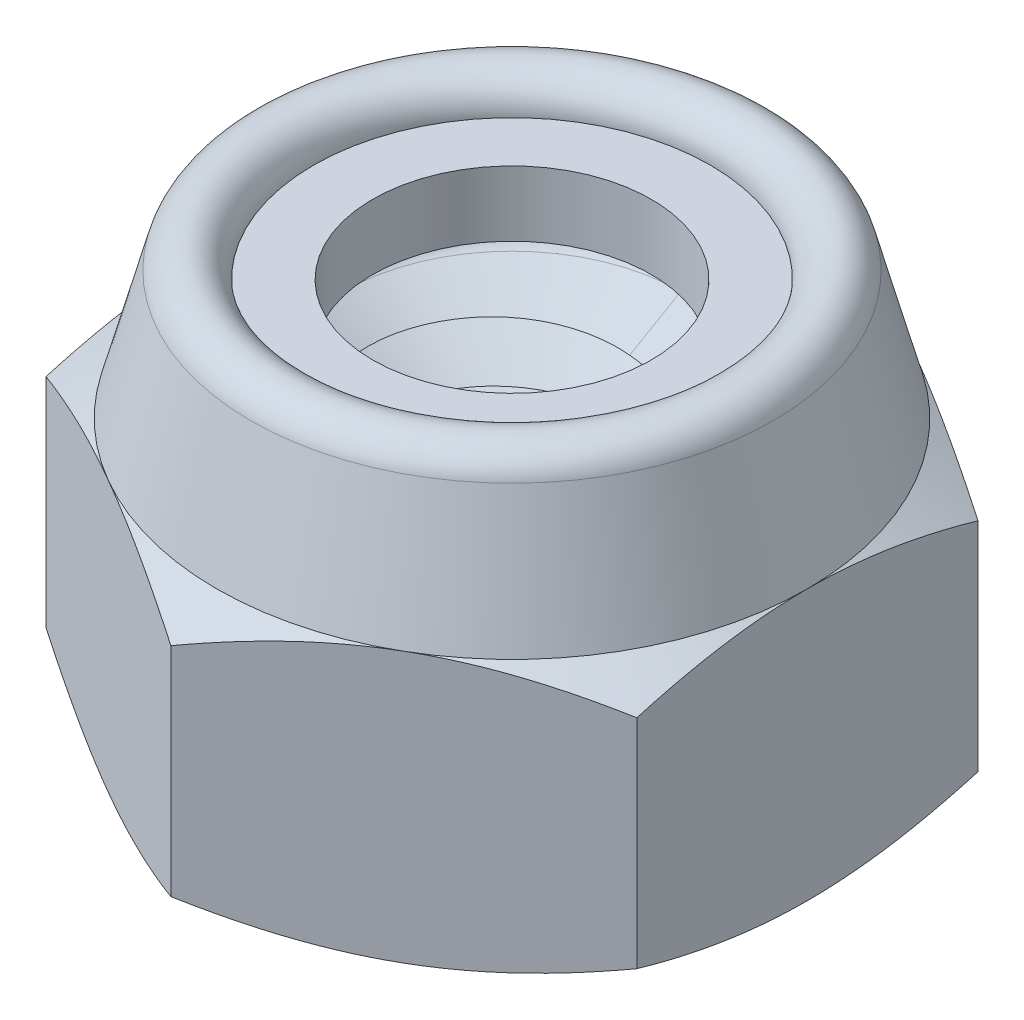
from build123d import *
from build123d.topology import SkipClean

# Parameters (mm, degrees)
SKETCH2_R           = 2
BOSS_EXTRUDE1_DEPTH = 3.2
CUT_SWEEP1_PITCH    = 0.7


with BuildPart() as part:
    # Sketch1 → Revolve1 (revolve)
    with BuildSketch(Plane(origin=(0, 0, 0), x_dir=(0, 0, -1), z_dir=(1, 0, 0))):
        with BuildLine():
            Line((-1.393782217, 3.15), (-1.393782217, 0.35))
            Line((-1.393782217, 0.35), (-2, 0))
            Line((-2, 0), (-3.5, 0))
            Line((-3.5, 0), (-3.5, 3.2))
            Line((-3.5, 3.2), (-3.092721569, 4.719983799))
            ThreePointArc((-3.092721569, 4.719983799), (-2.678484901, 4.996767891), (-2.35, 4.622202649))
            Line((-2.35, 4.622202649), (-1.65, 4.622202649))
            Line((-1.65, 4.622202649), (-1.65, 3.85))
            Line((-1.65, 3.85), (-1.906217783, 3.85))
            ThreePointArc((-1.906217783, 3.85), (-2.087391114, 3.710980813), (-2, 3.5))
            Line((-2, 3.5), (-1.393782217, 3.15))
        make_face()
    revolve(axis=Axis((0, 0, 0), (0, -1, 0)))

    # Sketch2 → Boss-Extrude1 (add)
    with BuildSketch(Plane.XZ):
        Polygon((3.5, -2.020725942), (3.5, 2.020725942), (0, 4.041451884), (-3.5, 2.020725942), (-3.5, -2.020725942), (0, -4.041451884), align=None)
        Circle(SKETCH2_R, mode=Mode.SUBTRACT)
    extrude(amount=-BOSS_EXTRUDE1_DEPTH)

    # Sketch3 → Cut-Revolve1 (revolve, cut)
    with BuildSketch(Plane(origin=(0, 0, 0), x_dir=(0, 0, -1), z_dir=(1, 0, 0)), mode=Mode.PRIVATE) as cut_revolve1_sk:
        Polygon((-3.5, 3.2), (-4.041451884, 3.2), (-4.041451884, 2.887392609), align=None)
        Polygon((-3.5, 0), (-4.041451884, 0.312607391), (-4.041451884, 0), align=None)
    revolve(cut_revolve1_sk.sketch.rotate(Axis((0, 0, 0), (0, 1, 0)), 150), axis=Axis((0, 0, 0), (0, 1, 0)), mode=Mode.SUBTRACT)

    # Cut-Sweep1: the profile of Sketch5 screwed along a right-hand helix of 5.142857 turns, 6 arcs to a turn; built about Z, then put on its axis
    with SkipClean():  # the faces are left unmerged after this step: merging them gives an invalid solid
        cut_sweep1_z = Axis((0, 0, 0), (0, 0, 1))
        cut_sweep1_corners = [(2, 0, 0), (1.3, 0, -0.404145188), (1.3, 0, 0.404145188)]
        with BuildLine(mode=Mode.PRIVATE) as cut_sweep1_profile:
            Line(cut_sweep1_corners[0], cut_sweep1_corners[1])
            Line(cut_sweep1_corners[1], cut_sweep1_corners[2])
            Line(cut_sweep1_corners[2], cut_sweep1_corners[0])
        cut_sweep1_cap = Face(cut_sweep1_profile.wire())
        cut_sweep1_turn_angles = [0, 30, 60, 90, 120, 150, 180, 210, 240, 270, 300, 330, 360]
        cut_sweep1_turn_weights = [1, 0.8660254037844387, 1, 0.8660254037844387, 1, 0.8660254037844387, 1, 0.8660254037844387, 1, 0.8660254037844387, 1, 0.8660254037844387, 1]
        cut_sweep1_turn_rails = [Edge.make_bspline([Vector(p[0], p[1], 0).rotate(cut_sweep1_z, cut_sweep1_turn_angles[k]) / cut_sweep1_turn_weights[k] + Vector(0, 0, p[2] + CUT_SWEEP1_PITCH * cut_sweep1_turn_angles[k] / 360) for k in range(13)], [0, 0, 0, 1, 1, 2, 2, 3, 3, 4, 4, 5, 5, 6, 6, 6], 2, cut_sweep1_turn_weights) for p in cut_sweep1_corners]
        cut_sweep1_turn_sides = [Face.make_surface_from_curves(cut_sweep1_turn_rails[p[0]], cut_sweep1_turn_rails[p[1]]) for p in [(0, 1), (1, 2), (2, 0)]]
        cut_sweep1_last_angles = [1800, 1825.714285714, 1851.428571429]
        cut_sweep1_last_weights = [1, 0.9009688679024273, 1]
        cut_sweep1_last_rails = [Edge.make_bspline([Vector(p[0], p[1], 0).rotate(cut_sweep1_z, cut_sweep1_last_angles[k]) / cut_sweep1_last_weights[k] + Vector(0, 0, p[2] + CUT_SWEEP1_PITCH * cut_sweep1_last_angles[k] / 360) for k in range(3)], [0, 0, 0, 1, 1, 1], 2, cut_sweep1_last_weights) for p in cut_sweep1_corners]
        cut_sweep1_last_sides = [Face.make_surface_from_curves(cut_sweep1_last_rails[p[0]], cut_sweep1_last_rails[p[1]]) for p in [(0, 1), (1, 2), (2, 0)]]
        cut_sweep1 = Plane(origin=(0, 0, 0), x_dir=(0, 0, -1), z_dir=(0, 1, 0)) * Solid(Shell([*[p.moved(Location((0, 0, CUT_SWEEP1_PITCH * i))) for i in range(5) for p in cut_sweep1_turn_sides], *cut_sweep1_last_sides, cut_sweep1_cap, cut_sweep1_cap.rotate(cut_sweep1_z, 1851.428571429).moved(Location((0, 0, CUT_SWEEP1_PITCH * 1851.428571429 / 360)))]))
        add(cut_sweep1, mode=Mode.SUBTRACT)


solid = part.part
